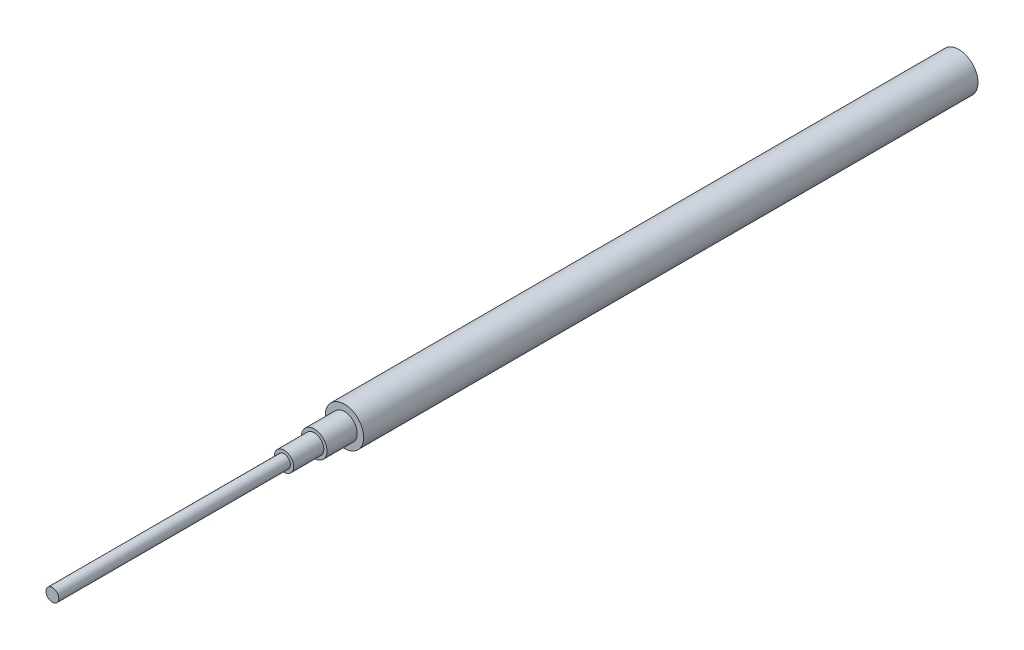
from build123d import *

# Parameters (mm, degrees)
SKETCH1_R           = 4.7625
BOSS_EXTRUDE1_DEPTH = 152.5
SKETCH2_R           = 3.175
BOSS_EXTRUDE2_DEPTH = 160
SKETCH3_R           = 2.38125
BOSS_EXTRUDE3_DEPTH = 167.5
SKETCH4_R           = 1.5875
BOSS_EXTRUDE4_DEPTH = 225


with BuildPart() as part:
    # Sketch1 → Boss-Extrude1 (new body)
    with BuildSketch(Plane.XY):
        Circle(SKETCH1_R)
    extrude(amount=BOSS_EXTRUDE1_DEPTH)

    # Sketch2 → Boss-Extrude2 (add)
    with BuildSketch(Plane.XY):
        Circle(SKETCH2_R)
    extrude(amount=BOSS_EXTRUDE2_DEPTH)

    # Sketch3 → Boss-Extrude3 (add)
    with BuildSketch(Plane.XY):
        Circle(SKETCH3_R)
    extrude(amount=BOSS_EXTRUDE3_DEPTH)

    # Sketch4 → Boss-Extrude4 (add)
    with BuildSketch(Plane.XY):
        Circle(SKETCH4_R)
    extrude(amount=BOSS_EXTRUDE4_DEPTH)


solid = part.part
